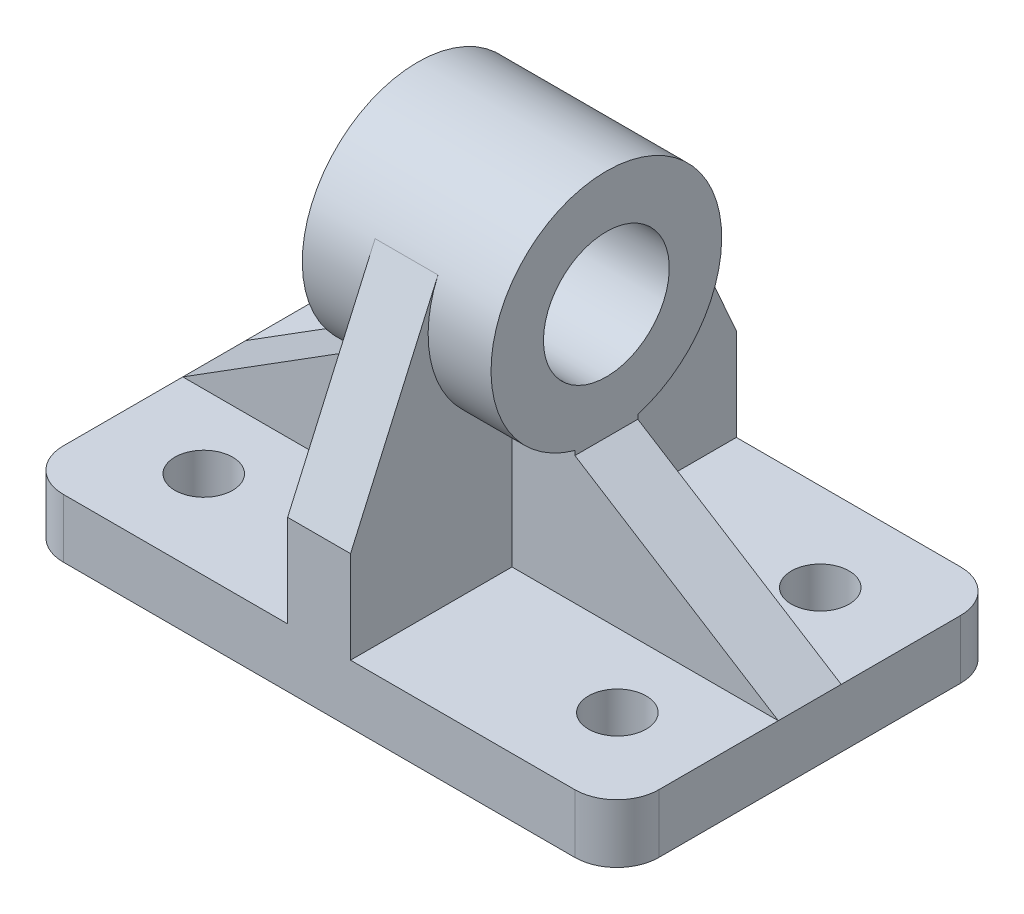
from build123d import *

# Parameters (mm, degrees)
SKETCH1_W           = 142
SKETCH1_H           = 92
BOSS_EXTRUDE1_DEPTH = 14
FILLET1_R           = 10
SKETCH2_R           = 27.5
SKETCH2_R_2         = 15
BOSS_EXTRUDE2_DEPTH = 22.5
BOSS_EXTRUDE3_DEPTH = 7.5
RIB1_START          = -7.5
RIB1_DEPTH          = 15
SKETCH6_R           = 6.879028827
CUT_EXTRUDE1_DEPTH  = 121.279881942


with BuildPart() as part:
    # Sketch1 → Boss-Extrude1 (new body)
    with BuildSketch(Plane(origin=(0, 0, 0), x_dir=(1, 0, 0), z_dir=(0, 1, 0))):
        Rectangle(SKETCH1_W, SKETCH1_H)
    extrude(amount=BOSS_EXTRUDE1_DEPTH)

    # Fillet1
    fillet1_edges = [part.edges().sort_by_distance(p)[0] for p in [
        (71, 7, 46),
        (-71, 7, 46),
        (-71, 7, -46),
        (71, 7, -46),
    ]]
    fillet(fillet1_edges, radius=FILLET1_R)



with BuildPart() as body_2:
    # Sketch2 → Boss-Extrude2 (new, symmetric)
    with BuildSketch(Plane(origin=(0, 0, 0), x_dir=(0, 0, -1), z_dir=(1, 0, 0))):
        with Locations(Location((0, 72, 0), (0, 0, 180))):
            Circle(SKETCH2_R)
        with Locations(Location((0, 72, 0), (0, 0, 180))):
            Circle(SKETCH2_R_2, mode=Mode.SUBTRACT)
    extrude(amount=BOSS_EXTRUDE2_DEPTH, both=True)


with BuildPart() as part_1:
    add(part.part)

    add(body_2.part)  # Boss-Extrude3 merges body 2
    # Sketch4 → Boss-Extrude3 (add, symmetric)
    with BuildSketch(Plane(origin=(0, 0, 0), x_dir=(0, 0, -1), z_dir=(1, 0, 0))):
        with BuildLine():
            Line((-25.148338126, 83.127043161), (-46, 36))
            Line((-46, 36), (-46, 14))
            Line((-46, 14), (46, 14))
            Line((46, 14), (46, 36))
            Line((46, 36), (25.148338126, 83.127043161))
            ThreePointArc((25.148338126, 83.127043161), (0, 44.5), (-25.148338126, 83.127043161))
        make_face()
    extrude(amount=BOSS_EXTRUDE3_DEPTH, both=True)

    # Rib1: read off the stored shape, not the designer's step
    # Rib1 outline → Rib1 (add)
    with BuildSketch(Plane.XY.offset(RIB1_START)):
        Polygon((-7.5, 14), (-7.5, 45.542486889), (-22.5, 45.542486889), (-22.5, 44.5), (-71, 14), align=None)
    rib1 = extrude(amount=RIB1_DEPTH)

    # Mirror1: Rib1 across plane
    add(rib1.mirror(Plane(origin=(0, 0, 0), x_dir=(0, 0, 1), z_dir=(1, 0, 0))))

    # Sketch6 → Cut-Extrude1 (cut, through all)
    with BuildSketch(Plane(origin=(0, 14, 0), x_dir=(1, 0, 0), z_dir=(0, 1, 0))):
        with Locations(Location((-48.5, 25, 0), (0, 0, 270))):
            Circle(SKETCH6_R)
        with Locations(Location((-48.5, -25, 0), (0, 0, 270))):
            Circle(SKETCH6_R)
        with Locations(Location((48.5, 25, 0), (0, 0, 270))):
            Circle(SKETCH6_R)
        with Locations(Location((50.121402644, -25, 0), (0, 0, 270))):
            Circle(SKETCH6_R)
    extrude(amount=-CUT_EXTRUDE1_DEPTH, mode=Mode.SUBTRACT)


solid = part_1.part
